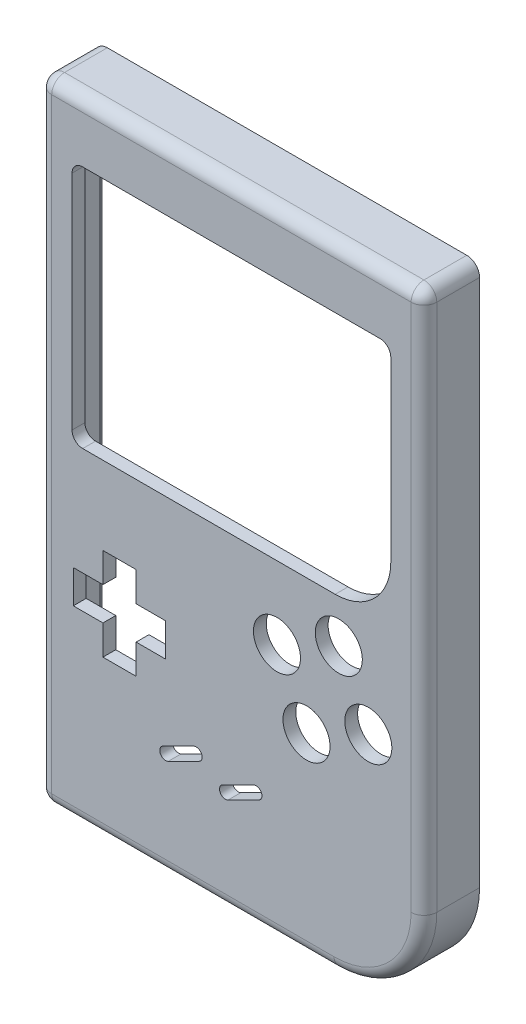
from build123d import *

# Parameters (mm, degrees)
SKETCH1_W               = 90
SKETCH1_H               = 147.5
BOSS_EXTRUDE1_DEPTH     = 13
ROUNDED_BOTTOM_CORNER_R = 21
ROUND_EDGES_R           = 3
SHELL2_DEPTH            = 10
CUT_EXTRUDE1_DEPTH      = 88.367399526
CUT_EXTRUDE2_DEPTH      = 1.75
CUT_EXTRUDE3_REACH      = 156.759
SKETCH6_R               = 5.5
CUT_EXTRUDE4_DEPTH      = 88.367399526
SKETCH7_W               = 7.75
SKETCH7_H               = 21.6
SKETCH7_W_2             = 21.6
SKETCH7_H_2             = 7.75
CUT_EXTRUDE5_DEPTH      = 88.367399526
CUT_EXTRUDE6_DEPTH      = 88.367399526


# Read off the part's stored shape, not the designer's step: Shell2
with BuildPart() as part:
    # Sketch1 → Boss-Extrude1 (new body)
    with BuildSketch(Plane.XY):
        Rectangle(SKETCH1_W, SKETCH1_H)
    extrude(amount=BOSS_EXTRUDE1_DEPTH)

    # Rounded Bottom Corner
    rounded_bottom_corner_edges = [part.edges().sort_by_distance(p)[0] for p in [
        (45, -73.75, 6.5),
    ]]
    fillet(rounded_bottom_corner_edges, radius=ROUNDED_BOTTOM_CORNER_R)

    # Round Edges
    round_edges_edges = [part.edges().sort_by_distance(p)[0] for p in [
        (-45, 0, 13),
        (-10.5, -73.75, 13),
        (45, 10.5, 13),
        (38.849242405, -67.599242405, 13),
        (0, 73.75, 13),
        (-45, -73.75, 6.5),
        (-45, 73.75, 6.5),
        (45, 73.75, 6.5),
    ]]
    fillet(round_edges_edges, radius=ROUND_EDGES_R)

    # Shell2 outline → Shell2 (cut)
    with BuildSketch(Plane.XY):
        with BuildLine():
            Line((42, -52.75), (42, 70.75))
            Line((42, 70.75), (-42, 70.75))
            Line((-42, 70.75), (-42, -70.75))
            Line((-42, -70.75), (24, -70.75))
            ThreePointArc((24, -70.75), (36.727922061, -65.477922061), (42, -52.75))
        make_face()
    extrude(amount=SHELL2_DEPTH, mode=Mode.SUBTRACT)

    # Sketch2 → Cut-Extrude1 (cut, through all)
    with BuildSketch(Plane.XY.offset(13)):
        with BuildLine():
            Line((-34.75, 59.75), (34.75, 59.75))
            ThreePointArc((34.75, 59.75), (36.517766953, 59.017766953), (37.25, 57.25))
            Line((37.25, 57.25), (37.25, 15.75))
            ThreePointArc((37.25, 15.75), (33.442388155, 6.557611845), (24.25, 2.75))
            Line((24.25, 2.75), (-34.75, 2.75))
            ThreePointArc((-34.75, 2.75), (-36.517766953, 3.482233047), (-37.25, 5.25))
            Line((-37.25, 5.25), (-37.25, 57.25))
            ThreePointArc((-37.25, 57.25), (-36.517766953, 59.017766953), (-34.75, 59.75))
        make_face()
    extrude(amount=-CUT_EXTRUDE1_DEPTH, mode=Mode.SUBTRACT)

    # Sketch3 → Cut-Extrude2 (cut)
    with BuildSketch(Plane(origin=(0, 0, 0), x_dir=(-1, 0, 0), z_dir=(0, 0, -1))):
        with BuildLine():
            Line((-43.25, -52.75), (-43.25, 72))
            Line((-43.25, 72), (43.25, 72))
            Line((43.25, 72), (43.25, -72))
            Line((43.25, -72), (-24, -72))
            ThreePointArc((-24, -72), (-37.611805538, -66.361805538), (-43.25, -52.75))
        make_face()
        with BuildLine():
            Line((-42, -52.75), (-42, 70.75))
            Line((-42, 70.75), (42, 70.75))
            Line((42, 70.75), (42, -70.75))
            Line((42, -70.75), (-24, -70.75))
            ThreePointArc((-24, -70.75), (-36.727922061, -65.477922061), (-42, -52.75))
        make_face(mode=Mode.SUBTRACT)
    extrude(amount=-CUT_EXTRUDE2_DEPTH, mode=Mode.SUBTRACT)

    # Sketch4 → Cut-Extrude3 (cut, up to next)
    with BuildSketch(Plane.XZ.offset(73.75), mode=Mode.PRIVATE) as cut_extrude3_sk1:
        with BuildLine():
            Line((-3.5, 0), (3.5, 0))
            Line((3.5, 0), (3.5, 4))
            ThreePointArc((3.5, 4), (0, 7.5), (-3.5, 4))
            Line((-3.5, 4), (-3.5, 0))
        make_face()
    cut_extrude3_tool1 = extrude(cut_extrude3_sk1.sketch, amount=-CUT_EXTRUDE3_REACH, mode=Mode.PRIVATE) & part.part
    add(cut_extrude3_tool1.solids().sort_by_distance((0, -73.75, 3.419658))[0], mode=Mode.SUBTRACT)

    # Sketch6 → Cut-Extrude4 (cut, through all)
    with BuildSketch(Plane.XY.offset(13)):
        with Locations((32, -21.75)):
            Circle(SKETCH6_R)
        with Locations((17.546893068, -28.66)):
            Circle(SKETCH6_R)
        with Locations((25.098626717, -7.314936896)):
            Circle(SKETCH6_R)
        with Locations((10.645519784, -14.224936896)):
            Circle(SKETCH6_R)
    extrude(amount=-CUT_EXTRUDE4_DEPTH, mode=Mode.SUBTRACT)

    # Sketch7 → Cut-Extrude5 (cut, through all)
    with BuildSketch(Plane.XY.offset(13)):
        with Locations((-26.15, -26.31)):
            Rectangle(SKETCH7_W, SKETCH7_H)
        with Locations((-26.15, -26.31)):
            Rectangle(SKETCH7_W_2, SKETCH7_H_2)
    extrude(amount=-CUT_EXTRUDE5_DEPTH, mode=Mode.SUBTRACT)

    # Sketch8 → Cut-Extrude6 (cut, through all)
    with BuildSketch(Plane.XY.offset(13)):
        with BuildLine():
            Line((-2.01359375, -48.949501032), (5.145672972, -45.379501032))
            ThreePointArc((5.145672972, -45.379501032), (6.98976569, -45.99640625), (6.372860472, -47.840498968))
            Line((6.372860472, -47.840498968), (-0.78640625, -51.410498968))
            ThreePointArc((-0.78640625, -51.410498968), (-2.630498968, -50.79359375), (-2.01359375, -48.949501032))
        make_face()
        with BuildLine():
            Line((-15.98359375, -48.099501032), (-8.824327028, -44.529501032))
            ThreePointArc((-8.824327028, -44.529501032), (-6.98023431, -45.14640625), (-7.597139528, -46.990498968))
            Line((-7.597139528, -46.990498968), (-14.75640625, -50.560498968))
            ThreePointArc((-14.75640625, -50.560498968), (-16.600498968, -49.94359375), (-15.98359375, -48.099501032))
        make_face()
    extrude(amount=-CUT_EXTRUDE6_DEPTH, mode=Mode.SUBTRACT)


solid = part.part
